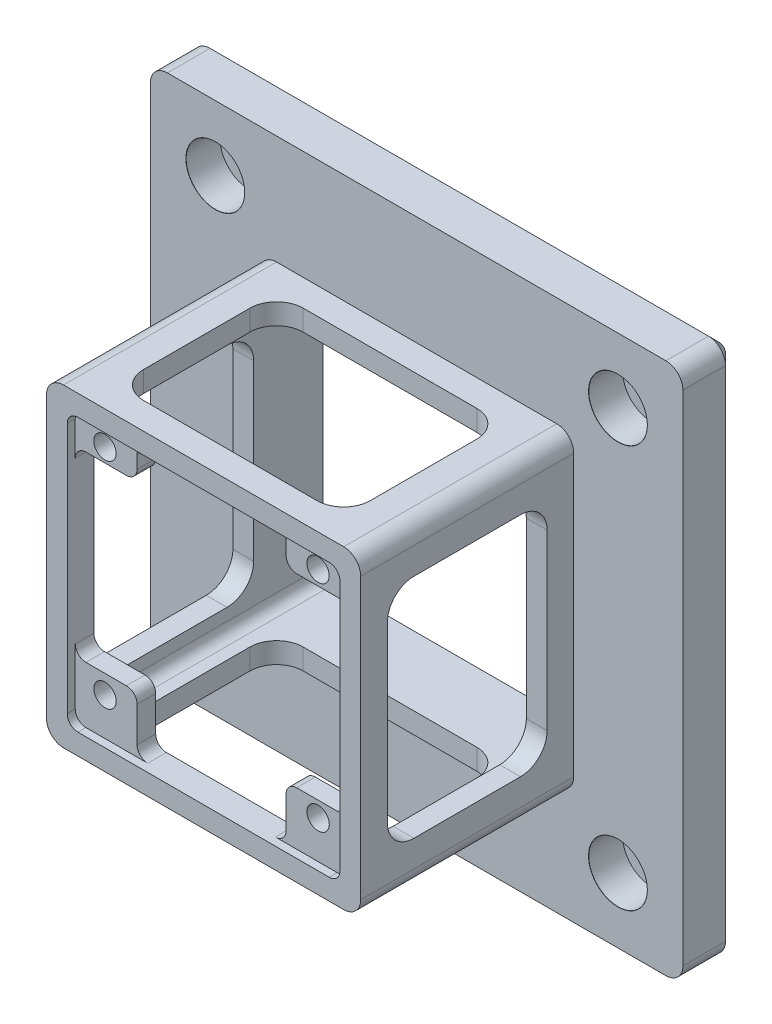
from build123d import *

# Parameters (mm, degrees)
SKETCH2_W                                    = 100
SKETCH2_H                                    = 100
SKETCH2_W_2                                  = 51.2
SKETCH2_H_2                                  = 51.2
BOSS_EXTRUDE1_DEPTH                          = 10
CBORE_FOR_M6_HEX_SOCKET_HEAD_CAP_SCR_2_COUNT = 2
CBORE_FOR_M6_HEX_SOCKET_HEAD_CAP_SCR_2_PITCH = 75.6
CBORE_FOR_M6_HEX_SOCKET_HEAD_CAP_SCR_3_COUNT = 2
CBORE_FOR_M6_HEX_SOCKET_HEAD_CAP_SCR_3_PITCH = 106.914545315
CBORE_FOR_M6_HEX_SOCKET_HEAD_CAP_SCR_4_COUNT = 2
CBORE_FOR_M6_HEX_SOCKET_HEAD_CAP_SCR_4_PITCH = 75.6
SKETCH7_W                                    = 59
SKETCH7_H                                    = 59
SKETCH7_W_2                                  = 51.2
SKETCH7_H_2                                  = 51.2
BOSS_EXTRUDE2_DEPTH                          = 40
SKETCH8_W                                    = 11.608814293
SKETCH8_H                                    = 6.4
SKETCH8_R                                    = 2.1
BOSS_EXTRUDE3_DEPTH                          = 5
FILLET1_R                                    = 3.2
SKETCH11_W                                   = 42.6
SKETCH11_H                                   = 30
CUT_EXTRUDE2_DEPTH                           = 107.396663482
SKETCH12_W                                   = 42.6
SKETCH12_H                                   = 30
CUT_EXTRUDE3_DEPTH                           = 107.396663482
FILLET3_R                                    = 5
FILLET4_R                                    = 5
CHAMFER2_SIZE                                = 2
CHAMFER3_SIZE                                = 2
SKETCH13_W                                   = 51.2
SKETCH13_H                                   = 51.2
CUT_EXTRUDE4_DEPTH                           = 1.5
FILLET5_R                                    = 2


with BuildPart() as part:
    # Sketch2 → Boss-Extrude1 (new body)
    with BuildSketch(Plane(origin=(0, 0, 0), x_dir=(0, 1, 0), z_dir=(0, 0, 1))):
        Rectangle(SKETCH2_W, SKETCH2_H)
        Rectangle(SKETCH2_W_2, SKETCH2_H_2, mode=Mode.SUBTRACT)
    extrude(amount=BOSS_EXTRUDE1_DEPTH)

    # Sketch6 → CBORE for M6 Hex Socket Head Cap Screw1 (revolve, cut)
    with BuildSketch(Plane(origin=(-37.8, 37.8, 10), x_dir=(0, -1, 0), z_dir=(1, 0, 0))):
        Polygon((0, 0), (0, 10), (3.3, 10), (3.3, 6.4), (5.5, 6.4), (5.5, 0.025), (5.525, 0), align=None)
    cbore_for_m6_hex_socket_head_cap_screw1 = revolve(axis=Axis((-37.8, 37.8, 16.35), (0, 0, -1)), mode=Mode.SUBTRACT)

    # CBORE for M6 Hex Socket Head Cap Scr 2: CBORE for M6 Hex Socket Head Cap Screw1 ×2
    with Locations(*[(i * CBORE_FOR_M6_HEX_SOCKET_HEAD_CAP_SCR_2_PITCH, 0, 0) for i in range(1, CBORE_FOR_M6_HEX_SOCKET_HEAD_CAP_SCR_2_COUNT)]):
        add(cbore_for_m6_hex_socket_head_cap_screw1, mode=Mode.SUBTRACT)

    # CBORE for M6 Hex Socket Head Cap Scr 3: CBORE for M6 Hex Socket Head Cap Screw1 ×2
    with Locations(*[Vector(0.7071067811865475, -0.7071067811865476, 0) * (i * CBORE_FOR_M6_HEX_SOCKET_HEAD_CAP_SCR_3_PITCH) for i in range(1, CBORE_FOR_M6_HEX_SOCKET_HEAD_CAP_SCR_3_COUNT)]):
        add(cbore_for_m6_hex_socket_head_cap_screw1, mode=Mode.SUBTRACT)

    # CBORE for M6 Hex Socket Head Cap Scr 4: CBORE for M6 Hex Socket Head Cap Screw1 ×2
    with Locations(*[(0, -i * CBORE_FOR_M6_HEX_SOCKET_HEAD_CAP_SCR_4_PITCH, 0) for i in range(1, CBORE_FOR_M6_HEX_SOCKET_HEAD_CAP_SCR_4_COUNT)]):
        add(cbore_for_m6_hex_socket_head_cap_screw1, mode=Mode.SUBTRACT)

    # Sketch7 → Boss-Extrude2 (add)
    with BuildSketch(Plane.XY.offset(10)):
        Rectangle(SKETCH7_W, SKETCH7_H)
        Rectangle(SKETCH7_W_2, SKETCH7_H_2, mode=Mode.SUBTRACT)
    extrude(amount=BOSS_EXTRUDE2_DEPTH)

    # Sketch8 → Boss-Extrude3 (add)
    # profile 1 of 4: a face of its own
    with BuildSketch(Plane.XY.offset(50)):
        Polygon((13.991185707, -25.6), (20, -25.6), (25.6, -25.6), (25.6, -17.5), (25.6, -15.6), (13.991185707, -15.6), (13.991185707, -17.5), align=None)
        with BuildLine():
            ThreePointArc((22.1, -18.5), (21.48492424, -19.98492424), (20, -20.6))
            ThreePointArc((20, -20.6), (18.51507576, -17.01507576), (22.1, -18.5))
        make_face(mode=Mode.SUBTRACT)
    # profile 2 of 4: a face of its own
    with BuildSketch(Plane.XY.offset(50)):
        Polygon((-20, -25.6), (-13.991185707, -25.6), (-13.991185707, -17.5), (-13.991185707, -15), (-25.6, -15), (-25.6, -17.5), (-25.6, -25.6), align=None)
        with BuildLine():
            ThreePointArc((-17.9, -18.5), (-18.51507576, -19.98492424), (-20, -20.6))
            ThreePointArc((-20, -20.6), (-21.48492424, -17.01507576), (-17.9, -18.5))
        make_face(mode=Mode.SUBTRACT)
    # profile 3 of 4: a face of its own
    with BuildSketch(Plane.XY.offset(50)):
        Polygon((19.986052448, 25.6), (13.991185707, 25.6), (13.991185707, 19.2), (25.6, 19.2), (25.6, 25.6), align=None)
        with BuildLine():
            ThreePointArc((22.086052448, 21.9), (18.501128208, 20.41507576), (19.986052448, 24))
            ThreePointArc((19.986052448, 24), (21.470976689, 23.38492424), (22.086052448, 21.9))
        make_face(mode=Mode.SUBTRACT)
    # profile 4 of 4: a face of its own
    with BuildSketch(Plane.XY.offset(50)):
        with Locations((-19.795592854, 22.4)):
            Rectangle(SKETCH8_W, SKETCH8_H)
        with Locations((-20.013947552, 21.800522552)):
            Circle(SKETCH8_R, mode=Mode.SUBTRACT)
    extrude(amount=-BOSS_EXTRUDE3_DEPTH)

    # Fillet1
    fillet1_edges = [part.edges().sort_by_distance(p)[0] for p in [
        (-29.5, -29.5, 30),
        (29.5, -29.5, 30),
        (50, -50, 5),
        (29.5, 29.5, 30),
        (-50, -50, 5),
        (-50, 50, 5),
        (-29.5, 29.5, 30),
        (50, 50, 5),
    ]]
    fillet(fillet1_edges, radius=FILLET1_R)

    # Sketch11 → Cut-Extrude2 (cut, through all)
    with BuildSketch(Plane(origin=(-29.5, 0, 0), x_dir=(0, -1, 0), z_dir=(-1, 0, 0))):
        with Locations((0, 30)):
            Rectangle(SKETCH11_W, SKETCH11_H)
    extrude(amount=-CUT_EXTRUDE2_DEPTH, mode=Mode.SUBTRACT)

    # Sketch12 → Cut-Extrude3 (cut, through all)
    with BuildSketch(Plane.XZ.offset(29.5)):
        with Locations((0, 30)):
            Rectangle(SKETCH12_W, SKETCH12_H)
    extrude(amount=-CUT_EXTRUDE3_DEPTH, mode=Mode.SUBTRACT)

    # Fillet3
    # the kernel refuses this fillet: 5 mm, written as the material it adds along each edge
    with BuildSketch(Plane(origin=(-29.5, -21.3, 15), x_dir=(0, 1, 0), z_dir=(1, 0, 0)), Plane(origin=(-29.5, -21.3, 45), x_dir=(0, 0, -1), z_dir=(1, 0, 0)), Plane(origin=(25.6, -21.3, 45), x_dir=(0, 0, -1), z_dir=(1, 0, 0)), Plane(origin=(-21.3, -29.5, 15), x_dir=(0, 0, 1), z_dir=(0, 1, 0)), Plane(origin=(21.3, 25.6, 45), x_dir=(0, 0, -1), z_dir=(0, 1, 0))) as fillet3_piece_1:
        with BuildLine():
            CenterArc((FILLET3_R, FILLET3_R), FILLET3_R, 180, 90)
            Line((0, FILLET3_R), (0, 0))
            Line((0, 0), (FILLET3_R, 0))
        make_face()
    extrude(amount=3.9)
    with BuildSketch(Plane(origin=(25.6, -21.3, 15), x_dir=(0, 0, 1), z_dir=(1, 0, 0)), Plane(origin=(25.6, 21.3, 15), x_dir=(0, -1, 0), z_dir=(1, 0, 0)), Plane(origin=(25.6, 21.3, 45), x_dir=(0, 0, -1), z_dir=(1, 0, 0)), Plane(origin=(-21.3, -29.5, 45), x_dir=(0, 0, -1), z_dir=(0, 1, 0)), Plane(origin=(-21.3, 25.6, 45), x_dir=(0, 0, -1), z_dir=(0, 1, 0)), Plane(origin=(21.3, 25.6, 15), x_dir=(0, 0, 1), z_dir=(0, 1, 0)), Plane(origin=(-21.3, 25.6, 15), x_dir=(1, 0, 0), z_dir=(0, 1, 0))) as fillet3_piece_2:
        with BuildLine():
            CenterArc((FILLET3_R, -FILLET3_R), FILLET3_R, 90, 90)
            Line((0, -FILLET3_R), (0, 0))
            Line((0, 0), (FILLET3_R, 0))
        make_face()
    extrude(amount=3.9)

    # Fillet4
    # the kernel refuses this fillet: 5 mm, written as the material it adds along each edge
    with BuildSketch(Plane(origin=(-29.5, 21.3, 15), x_dir=(0, 0, 1), z_dir=(1, 0, 0)), Plane(origin=(21.3, -29.5, 45), x_dir=(0, 0, -1), z_dir=(0, 1, 0))) as fillet4_piece_1:
        with BuildLine():
            CenterArc((FILLET4_R, FILLET4_R), FILLET4_R, 180, 90)
            Line((0, FILLET4_R), (0, 0))
            Line((0, 0), (FILLET4_R, 0))
        make_face()
    extrude(amount=3.9)
    with BuildSketch(Plane(origin=(-29.5, 21.3, 45), x_dir=(0, 0, -1), z_dir=(1, 0, 0)), Plane(origin=(21.3, -29.5, 15), x_dir=(0, 0, 1), z_dir=(0, 1, 0))) as fillet4_piece_2:
        with BuildLine():
            CenterArc((FILLET4_R, -FILLET4_R), FILLET4_R, 90, 90)
            Line((0, -FILLET4_R), (0, 0))
            Line((0, 0), (FILLET4_R, 0))
        make_face()
    extrude(amount=3.9)

    # Chamfer2
    chamfer2_edges = [part.edges().sort_by_distance(p)[0] for p in [
        (0, -50, 0),
        (50, 0, 0),
        (-50, 0, 0),
        (0, 50, 0),
        (-49.0627417, 49.0627417, 0),
        (49.0627417, 49.0627417, 0),
        (49.0627417, -49.0627417, 0),
        (-49.0627417, -49.0627417, 0),
    ]]
    chamfer(chamfer2_edges, length=CHAMFER2_SIZE)

    # Chamfer3
    chamfer3_edges = [part.edges().sort_by_distance(p)[0] for p in [
        (25.6, 0, 0),
        (0, 25.6, 0),
        (0, -25.6, 0),
        (-25.6, 0, 0),
    ]]
    chamfer(chamfer3_edges, length=CHAMFER3_SIZE)

    # Sketch13 → Cut-Extrude4 (cut)
    with BuildSketch(Plane.XY.offset(50)):
        Rectangle(SKETCH13_W, SKETCH13_H)
    extrude(amount=-CUT_EXTRUDE4_DEPTH, mode=Mode.SUBTRACT)

    # Fillet5
    fillet5_edges = [part.edges().sort_by_distance(p)[0] for p in [
        (-25.6, -25.6, 23.5),
        (25.6, -25.6, 23.5),
        (-25.6, 25.6, 23.5),
        (25.6, 25.6, 23.5),
        (-25.6, -15, 46.75),
        (-13.991185707, -15, 46.75),
        (-13.991185707, -25.6, 46.75),
        (13.991185707, -25.6, 46.75),
        (13.991185707, -15.6, 46.75),
        (25.6, -15.6, 46.75),
        (25.6, 19.2, 46.75),
        (13.991185707, 19.2, 46.75),
        (13.991185707, 25.6, 46.75),
        (-13.991185707, 19.2, 46.75),
        (-25.6, 19.2, 46.75),
        (-13.991185707, 25.6, 46.75),
        (25.6, 25.6, 49.25),
        (-25.6, -25.6, 49.25),
        (25.6, -25.6, 49.25),
        (-25.6, 25.6, 49.25),
    ]]
    fillet(fillet5_edges, radius=FILLET5_R)


solid = part.part
